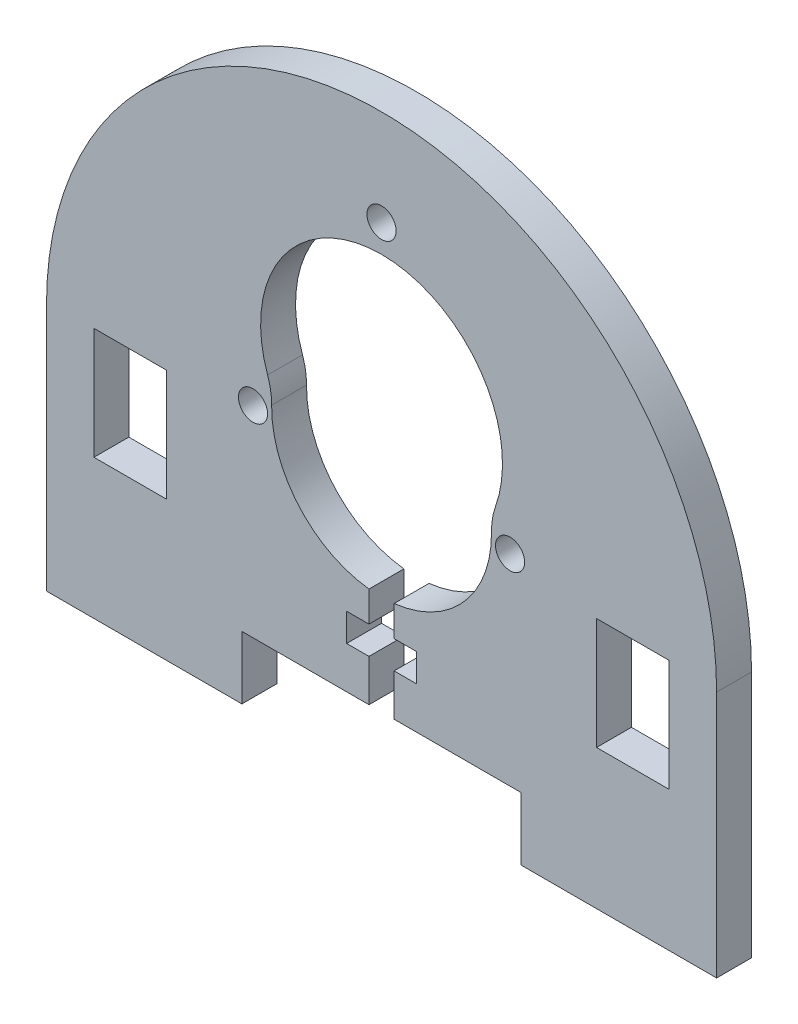
from build123d import *

# Parameters (mm, degrees)
BOSS_EXTRUDE1_DEPTH = 3.175
CUT_EXTRUDE1_REACH  = 53.782
SKETCH2_R           = 11
CUT_EXTRUDE2_REACH  = 53.782
SKETCH3_W           = 25.4
SKETCH3_H           = 5.715
CUT_EXTRUDE4_REACH  = 53.782
SKETCH6_R           = 1.3250037
CUT_EXTRUDE6_DEPTH  = 52.781708168
SKETCH7_R           = 10
CUT_EXTRUDE7_DEPTH  = 52.781708168
FILLET1_R           = 6.35
CUT_EXTRUDE8_REACH  = 53.782
SKETCH8_W           = 6.604
SKETCH8_H           = 10.16


with BuildPart() as part:
    # Sketch1 → Boss-Extrude1 (new body)
    with BuildSketch(Plane.XY):
        with BuildLine():
            Line((30.48, -11.260079969), (-30.48, -11.260079969))
            Line((-30.48, -11.260079969), (-30.48, 11.260079969))
            ThreePointArc((-30.48, 11.260079969), (0, 41.740079969), (30.48, 11.260079969))
            Line((30.48, 11.260079969), (30.48, -11.260079969))
        make_face()
    extrude(amount=BOSS_EXTRUDE1_DEPTH)

    # Sketch2 → Cut-Extrude1 (cut, up to next)
    with BuildSketch(Plane.XY.offset(3.175), mode=Mode.PRIVATE) as cut_extrude1_sk1:
        with Locations((0, 19.504919969)):
            Circle(SKETCH2_R)
    cut_extrude1_tool1 = extrude(cut_extrude1_sk1.sketch, amount=-CUT_EXTRUDE1_REACH, mode=Mode.PRIVATE) & part.part
    add(cut_extrude1_tool1.solids().sort_by_distance((0, 19.50492, 3.175))[0], mode=Mode.SUBTRACT)

    # Sketch3 → Cut-Extrude2 (cut, up to next)
    with BuildSketch(Plane.XY.offset(3.175), mode=Mode.PRIVATE) as cut_extrude2_sk1:
        with Locations((0, -8.402579969)):
            Rectangle(SKETCH3_W, SKETCH3_H)
    cut_extrude2_tool1 = extrude(cut_extrude2_sk1.sketch, amount=-CUT_EXTRUDE2_REACH, mode=Mode.PRIVATE) & part.part
    add(cut_extrude2_tool1.solids().sort_by_distance((0, -8.40258, 3.175))[0], mode=Mode.SUBTRACT)

    # Sketch5 → Cut-Extrude4 (cut, up to next)
    with BuildSketch(Plane.XY.offset(3.175), mode=Mode.PRIVATE) as cut_extrude4_sk1:
        Polygon((3.175, -1.735079969), (1.143, -1.735079969), (1.143, -5.545079969), (-1.143, -5.545079969), (-1.143, -1.735079969), (-3.175, -1.735079969), (-3.175, 0.804920031), (-1.143, 0.804920031), (-1.143, 9.694920031), (1.143, 9.694920031), (1.143, 0.804920031), (3.175, 0.804920031), align=None)
    cut_extrude4_tool1 = extrude(cut_extrude4_sk1.sketch, amount=-CUT_EXTRUDE4_REACH, mode=Mode.PRIVATE) & part.part
    add(cut_extrude4_tool1.solids().sort_by_distance((0, 1.494349, 3.175))[0], mode=Mode.SUBTRACT)

    # Sketch6 → Cut-Extrude6 (cut, through all)
    with BuildSketch(Plane.XY):
        with Locations((0, 33.004919969)):
            Circle(SKETCH6_R)
        with Locations((11.691342951, 12.754919969)):
            Circle(SKETCH6_R)
        with Locations((-11.691342951, 12.754919969)):
            Circle(SKETCH6_R)
    extrude(amount=CUT_EXTRUDE6_DEPTH, mode=Mode.SUBTRACT)

    # Sketch7 → Cut-Extrude7 (cut, through all)
    with BuildSketch(Plane.XY):
        with Locations((0, 13.504920031)):
            Circle(SKETCH7_R)
    extrude(amount=CUT_EXTRUDE7_DEPTH, mode=Mode.SUBTRACT)

    # Fillet1
    fillet1_edges = [part.edges().sort_by_distance(p)[0] for p in [
        (-9.921567423, 14.754919982, 1.5875),
        (9.921567423, 14.754919982, 1.5875),
    ]]
    fillet(fillet1_edges, radius=FILLET1_R)

    # Sketch8 → Cut-Extrude8 (cut, up to next)
    with BuildSketch(Plane.XY.offset(3.175), mode=Mode.PRIVATE) as cut_extrude8_sk1:
        with Locations((22.86, 6.519920031)):
            Rectangle(SKETCH8_W, SKETCH8_H)
    cut_extrude8_tool1 = extrude(cut_extrude8_sk1.sketch, amount=-CUT_EXTRUDE8_REACH, mode=Mode.PRIVATE) & part.part
    # Sketch8 → Cut-Extrude8 (cut, up to next)
    with BuildSketch(Plane.XY.offset(3.175), mode=Mode.PRIVATE) as cut_extrude8_sk2:
        with Locations((-22.86, 6.519920031)):
            Rectangle(SKETCH8_W, SKETCH8_H)
    cut_extrude8_tool2 = extrude(cut_extrude8_sk2.sketch, amount=-CUT_EXTRUDE8_REACH, mode=Mode.PRIVATE) & part.part
    add(cut_extrude8_tool1.solids().sort_by_distance((22.86, 6.51992, 3.175))[0], mode=Mode.SUBTRACT)
    add(cut_extrude8_tool2.solids().sort_by_distance((-22.86, 6.51992, 3.175))[0], mode=Mode.SUBTRACT)


solid = part.part
